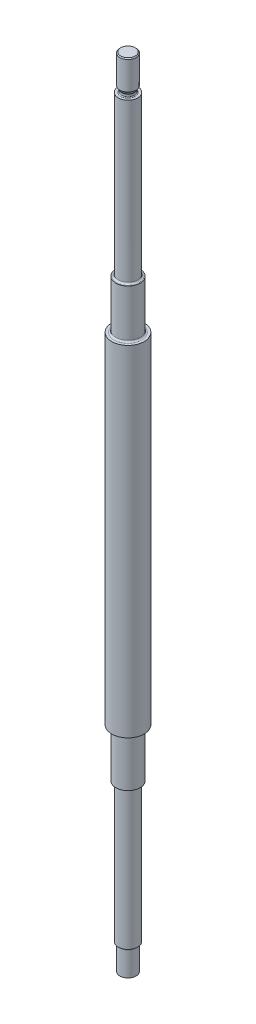
from build123d import *

# Parameters (mm, degrees)
SKETCH1_R           = 5
BOSS_EXTRUDE1_DEPTH = 16
SKETCH2_R           = 6
BOSS_EXTRUDE2_DEPTH = 86
SKETCH3_R           = 7.5
BOSS_EXTRUDE3_DEPTH = 30
SKETCH4_R           = 10
BOSS_EXTRUDE4_DEPTH = 210
SKETCH5_R           = 7.5
BOSS_EXTRUDE5_DEPTH = 30
SKETCH6_R           = 6
BOSS_EXTRUDE6_DEPTH = 95
SKETCH32_R          = 6
BOSS_EXTRUDE7_DEPTH = 25
CUT_EXTRUDE1_START  = -3.2
CUT_EXTRUDE1_DEPTH  = 490.003210067
FILLET1_R           = 1


# Read off the part's stored shape, not the designer's step: M10x1.0 Machine Threads Stud1
with BuildPart() as part:
    # Sketch1 → Boss-Extrude1 (new body)
    with BuildSketch(Plane(origin=(0, 0, 0), x_dir=(1, 0, 0), z_dir=(0, 1, 0))):
        with Locations(Location((0, 0, 0), (0, 0, 270))):
            Circle(SKETCH1_R)
    extrude(amount=BOSS_EXTRUDE1_DEPTH)

    # Sketch2 → Boss-Extrude2 (add)
    with BuildSketch(Plane(origin=(0, 16, 0), x_dir=(1, 0, 0), z_dir=(0, 1, 0))):
        with Locations(Location((0, 0, 0), (0, 0, 270))):
            Circle(SKETCH2_R)
    extrude(amount=BOSS_EXTRUDE2_DEPTH)

    # Sketch3 → Boss-Extrude3 (add)
    with BuildSketch(Plane(origin=(0, 102, 0), x_dir=(1, 0, 0), z_dir=(0, 1, 0))):
        with Locations(Location((0, 0, 0), (0, 0, 270))):
            Circle(SKETCH3_R)
    extrude(amount=BOSS_EXTRUDE3_DEPTH)

    # Sketch4 → Boss-Extrude4 (add)
    with BuildSketch(Plane(origin=(0, 132, 0), x_dir=(1, 0, 0), z_dir=(0, 1, 0))):
        with Locations(Location((0, 0, 0), (0, 0, 270))):
            Circle(SKETCH4_R)
    extrude(amount=BOSS_EXTRUDE4_DEPTH)

    # Sketch5 → Boss-Extrude5 (add)
    with BuildSketch(Plane(origin=(0, 342, 0), x_dir=(1, 0, 0), z_dir=(0, 1, 0))):
        with Locations(Location((0, 0, 0), (0, 0, 270))):
            Circle(SKETCH5_R)
    extrude(amount=BOSS_EXTRUDE5_DEPTH)

    # Sketch6 → Boss-Extrude6 (add)
    with BuildSketch(Plane(origin=(0, 372, 0), x_dir=(1, 0, 0), z_dir=(0, 1, 0))):
        with Locations(Location((0, 0, 0), (0, 0, 270))):
            Circle(SKETCH6_R)
    extrude(amount=BOSS_EXTRUDE6_DEPTH)

    # Sketch32 → Boss-Extrude7 (add)
    with BuildSketch(Plane(origin=(0, 467, 0), x_dir=(1, 0, 0), z_dir=(0, 1, 0))):
        with Locations(Location((0, 0, 0), (0, 0, 270))):
            Circle(SKETCH32_R)
    extrude(amount=BOSS_EXTRUDE7_DEPTH)

    # M10x1.0 Machine Threads Stud1 outline → M10x1.0 Machine Threads Stud1 (revolve, cut)
    with BuildSketch(Plane.XY):
        with BuildLine():
            Line((6, 492), (4.4455, 492))
            Line((4.4455, 492), (5, 491.4455))
            Line((5, 491.4455), (5, 474))
            Line((5, 474), (4.066987298, 472.383974596))
            ThreePointArc((4.066987298, 472.383974596), (4.017037087, 472.263384119), (4, 472.133974596))
            Line((4, 472.133974596), (4, 470.883974596))
            ThreePointArc((4, 470.883974596), (4.14644661, 470.530421205), (4.5, 470.383974596))
            Line((4.5, 470.383974596), (6, 470.383974596))
            Line((6, 470.383974596), (6, 492))
        make_face()
    revolve(axis=Axis((0, 0, 0), (0, 1, 0)), mode=Mode.SUBTRACT)

    # Sketch34 → Cut-Extrude1 (cut, through all)
    with BuildSketch(Plane.XY.offset(CUT_EXTRUDE1_START)):
        with BuildLine():
            Line((1.5, -11), (-1.5, -11))
            Line((-1.5, -11), (-1.5, 11))
            ThreePointArc((-1.5, 11), (0, 12.5), (1.5, 11))
            Line((1.5, 11), (1.5, -11))
        make_face()
    extrude(amount=-CUT_EXTRUDE1_DEPTH, mode=Mode.SUBTRACT)

    # Fillet1
    fillet1_edges = [part.edges().sort_by_distance(p)[0] for p in [
        (0, 132, -7.5),
        (0, 342, -7.5),
        (0, 372, -6),
        (0, 16, -5),
        (0, 102, -6),
    ]]
    fillet(fillet1_edges, radius=FILLET1_R - 0.0001)  # a hair under: the kernel refuses the full size


solid = part.part
